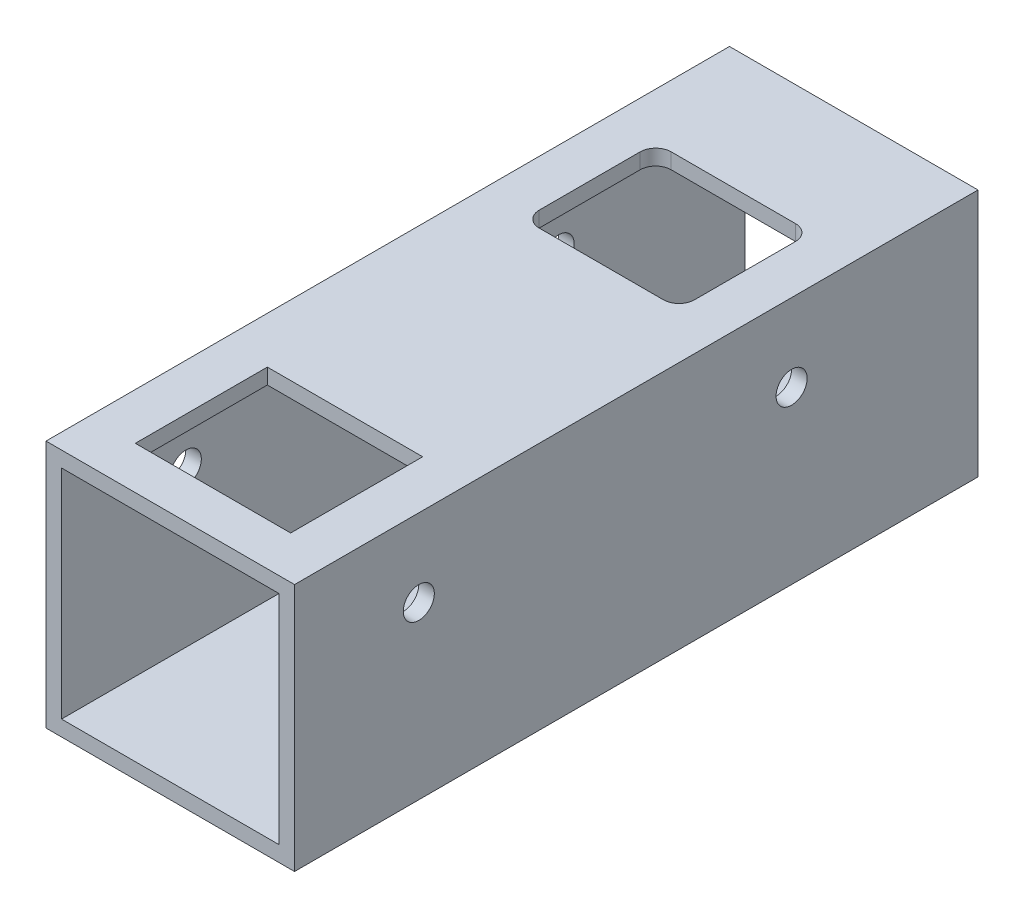
from build123d import *

# Parameters (mm, degrees)
SKETCH1_W               = 50.8
SKETCH1_H               = 50.8
BOSS_EXTRUDE1_DEPTH     = 69.85
SHELL1_T                = -3.175
SKETCH2_W               = 31.75
SKETCH2_H               = 26.9875
CUT_EXTRUDE1_DEPTH      = 79.545162168
FILLET1_R               = 3.175
CUT_EXTRUDE2_DEPTH      = 79.545162168
CUT_EXTRUDE2_DEPTH_BACK = 79.545162168
SKETCH3_R               = 3.175


with BuildPart() as part:
    # Sketch1 → Boss-Extrude1 (new, symmetric)
    with BuildSketch(Plane.XY):
        Rectangle(SKETCH1_W, SKETCH1_H)
    extrude(amount=BOSS_EXTRUDE1_DEPTH, both=True)

    # Shell1
    shell1_openings = [part.faces().sort_by_distance(p)[0] for p in [
        (0, 0, -69.85),
        (0, 0, 69.85),
    ]]
    offset(amount=SHELL1_T, openings=shell1_openings, kind=Kind.INTERSECTION)

    # Sketch2 → Cut-Extrude1 (cut, through all)
    with BuildSketch(Plane(origin=(0, 0, 0), x_dir=(1, 0, 0), z_dir=(0, 1, 0))):
        with Locations((0, 31.75)):
            Rectangle(SKETCH2_W, SKETCH2_H)
        with Locations((0, -47.625)):
            Rectangle(SKETCH2_W, SKETCH2_H)
    extrude(amount=CUT_EXTRUDE1_DEPTH, mode=Mode.SUBTRACT)

    # Fillet1
    fillet1_edges = [part.edges().sort_by_distance(p)[0] for p in [
        (15.875, 23.8125, -45.24375),
        (-15.875, 23.8125, -45.24375),
        (-15.875, 23.8125, -18.25625),
        (15.875, 23.8125, -18.25625),
    ]]
    fillet(fillet1_edges, radius=FILLET1_R)

    # Sketch3 → Cut-Extrude2 (cut, two sides: drawn at the far end of the back side and taken through both)
    with BuildSketch(Plane(origin=(0, 0, 0), x_dir=(0, 0, -1), z_dir=(1, 0, 0)).offset(-CUT_EXTRUDE2_DEPTH_BACK)):
        with Locations((31.75, 9.525)):
            Circle(SKETCH3_R)
        with Locations((-44.45, 9.525)):
            Circle(SKETCH3_R)
    extrude(amount=CUT_EXTRUDE2_DEPTH + CUT_EXTRUDE2_DEPTH_BACK, mode=Mode.SUBTRACT)


solid = part.part
